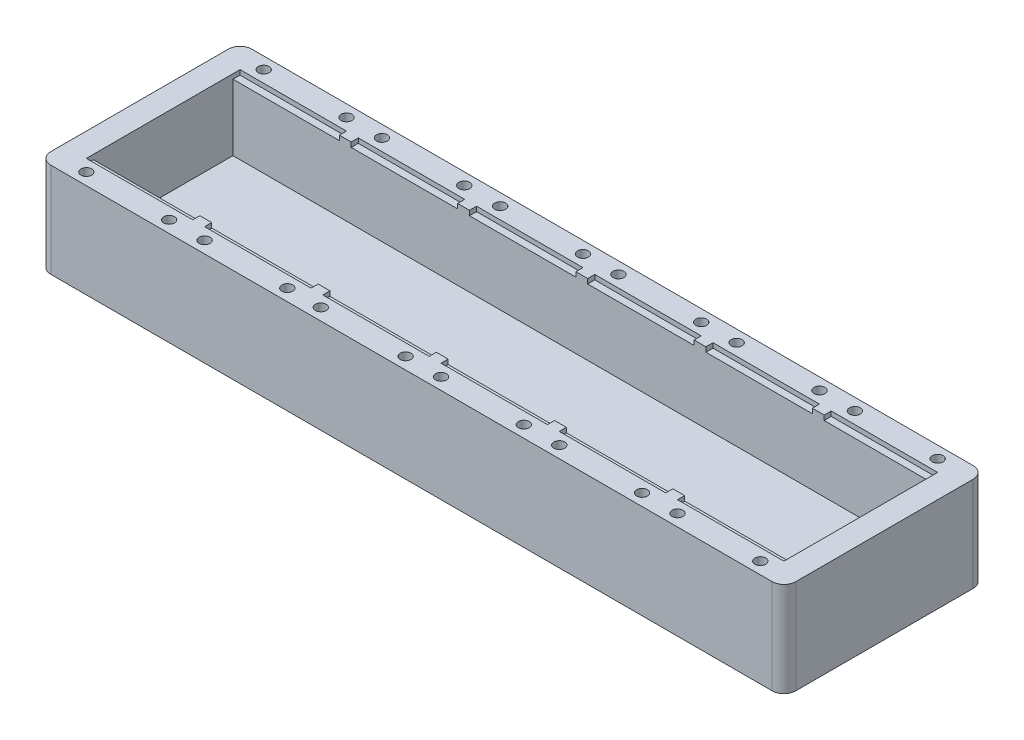
from build123d import *

# Parameters (mm, degrees)
SKIZZE2_W                       = 315
SKIZZE2_H                       = 40
AUFSATZ_LINEAR_AUSTRAGEN1_DEPTH = 85
SKIZZE4_W                       = 295
SKIZZE4_H                       = 59
SCHNITT_LINEAR_AUSTRAGEN1_DEPTH = 30
SKIZZE11_W                      = 45
SKIZZE11_H                      = 3
SKIZZE11_H_2                    = 3.008661904
SCHNITT_LINEAR_AUSTRAGEN4_DEPTH = 2
SKIZZE17_R                      = 2.3
SCHNITT_LINEAR_AUSTRAGEN6_DEPTH = 4
VERRUNDUNG2_R                   = 5
VERRUNDUNG3_R                   = 5
VERRUNDUNG4_R                   = 5
VERRUNDUNG6_R                   = 5


with BuildPart() as part:
    # Skizze2 → Aufsatz-Linear austragen1 (new body)
    with BuildSketch(Plane.XY):
        with Locations((157.5, 20)):
            Rectangle(SKIZZE2_W, SKIZZE2_H)
    extrude(amount=AUFSATZ_LINEAR_AUSTRAGEN1_DEPTH)

    # Skizze4 → Schnitt-Linear austragen1 (cut)
    with BuildSketch(Plane(origin=(0, 40, 0), x_dir=(1, 0, 0), z_dir=(0, 1, 0))):
        with Locations((157.5, -42.5)):
            Rectangle(SKIZZE4_W, SKIZZE4_H)
    extrude(amount=-SCHNITT_LINEAR_AUSTRAGEN1_DEPTH, mode=Mode.SUBTRACT)

    # Skizze11 → Schnitt-Linear austragen4 (cut)
    with BuildSketch(Plane(origin=(0, 40, 0), x_dir=(1, 0, 0), z_dir=(0, 1, 0))):
        with Locations((32.5, -11.5)):
            Rectangle(SKIZZE11_W, SKIZZE11_H)
        with Locations((32.5, -73.5)):
            Rectangle(SKIZZE11_W, SKIZZE11_H)
        with Locations((82.5, -73.5)):
            Rectangle(SKIZZE11_W, SKIZZE11_H)
        with Locations((132.5, -73.504330952)):
            Rectangle(SKIZZE11_W, SKIZZE11_H_2)
        with Locations((182.5, -73.504330952)):
            Rectangle(SKIZZE11_W, SKIZZE11_H_2)
        with Locations((232.5, -73.5)):
            Rectangle(SKIZZE11_W, SKIZZE11_H)
        with Locations((282.5, -73.5)):
            Rectangle(SKIZZE11_W, SKIZZE11_H)
        with Locations((282.5, -11.5)):
            Rectangle(SKIZZE11_W, SKIZZE11_H)
        with Locations((232.5, -11.5)):
            Rectangle(SKIZZE11_W, SKIZZE11_H)
        with Locations((182.5, -11.5)):
            Rectangle(SKIZZE11_W, SKIZZE11_H)
        with Locations((132.5, -11.5)):
            Rectangle(SKIZZE11_W, SKIZZE11_H)
        with Locations((82.5, -11.5)):
            Rectangle(SKIZZE11_W, SKIZZE11_H)
    extrude(amount=-SCHNITT_LINEAR_AUSTRAGEN4_DEPTH, mode=Mode.SUBTRACT)

    # Skizze17 → Schnitt-Linear austragen6 (cut)
    with BuildSketch(Plane(origin=(0, 40, 0), x_dir=(1, 0, 0), z_dir=(0, 1, 0))):
        with Locations((50, -80)):
            Circle(SKIZZE17_R)
        with Locations((15, -80)):
            Circle(SKIZZE17_R)
        with Locations((15, -5)):
            Circle(SKIZZE17_R)
        with Locations((50, -5)):
            Circle(SKIZZE17_R)
        with Locations((65, -5)):
            Circle(SKIZZE17_R)
        with Locations((99.834927097, -5)):
            Circle(SKIZZE17_R)
        with Locations((65, -80)):
            Circle(SKIZZE17_R)
        with Locations((100, -80)):
            Circle(SKIZZE17_R)
        with Locations((114.145512134, -80)):
            Circle(SKIZZE17_R)
        with Locations((150, -80)):
            Circle(SKIZZE17_R)
        with Locations((165, -80)):
            Circle(SKIZZE17_R)
        with Locations((200, -80)):
            Circle(SKIZZE17_R)
        with Locations((215, -80)):
            Circle(SKIZZE17_R)
        with Locations((250, -80)):
            Circle(SKIZZE17_R)
        with Locations((265, -80)):
            Circle(SKIZZE17_R)
        with Locations((300, -80)):
            Circle(SKIZZE17_R)
        with Locations((300, -5)):
            Circle(SKIZZE17_R)
        with Locations((265, -5)):
            Circle(SKIZZE17_R)
        with Locations((250, -5)):
            Circle(SKIZZE17_R)
        with Locations((215, -5)):
            Circle(SKIZZE17_R)
        with Locations((200, -5)):
            Circle(SKIZZE17_R)
        with Locations((165, -5)):
            Circle(SKIZZE17_R)
        with Locations((150, -5)):
            Circle(SKIZZE17_R)
        with Locations((115, -5)):
            Circle(SKIZZE17_R)
    extrude(amount=-SCHNITT_LINEAR_AUSTRAGEN6_DEPTH, mode=Mode.SUBTRACT)

    # Verrundung2
    verrundung2_edges = [part.edges().sort_by_distance(p)[0] for p in [
        (0, 20, 85),
    ]]
    fillet(verrundung2_edges, radius=VERRUNDUNG2_R)

    # Verrundung3
    verrundung3_edges = [part.edges().sort_by_distance(p)[0] for p in [
        (0, 20, 0),
    ]]
    fillet(verrundung3_edges, radius=VERRUNDUNG3_R)

    # Verrundung4
    verrundung4_edges = [part.edges().sort_by_distance(p)[0] for p in [
        (315, 20, 0),
    ]]
    fillet(verrundung4_edges, radius=VERRUNDUNG4_R)

    # Verrundung6
    verrundung6_edges = [part.edges().sort_by_distance(p)[0] for p in [
        (315, 20, 85),
    ]]
    fillet(verrundung6_edges, radius=VERRUNDUNG6_R)


solid = part.part
